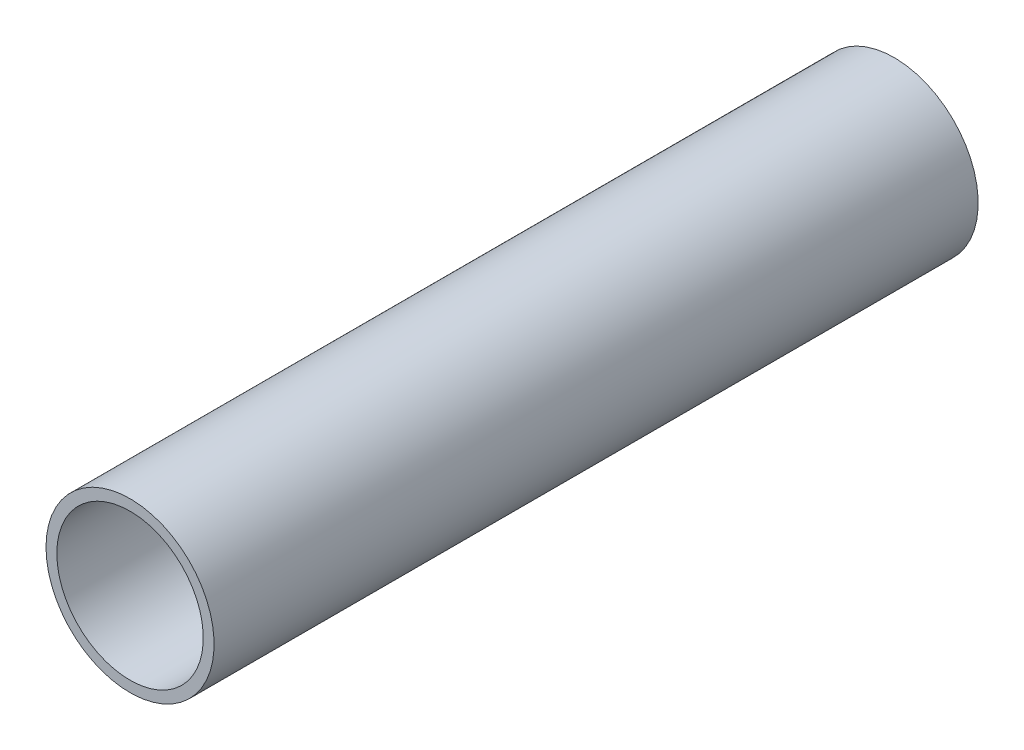
from build123d import *

# Parameters (mm, degrees)
SKETCH1_R           = 16.764
SKETCH1_R_2         = 14.605
BOSS_EXTRUDE1_DEPTH = 152.4


with BuildPart() as part:
    # Sketch1 → Boss-Extrude1 (new body)
    with BuildSketch(Plane.XY):
        Circle(SKETCH1_R)
        Circle(SKETCH1_R_2, mode=Mode.SUBTRACT)
    extrude(amount=BOSS_EXTRUDE1_DEPTH)


solid = part.part
